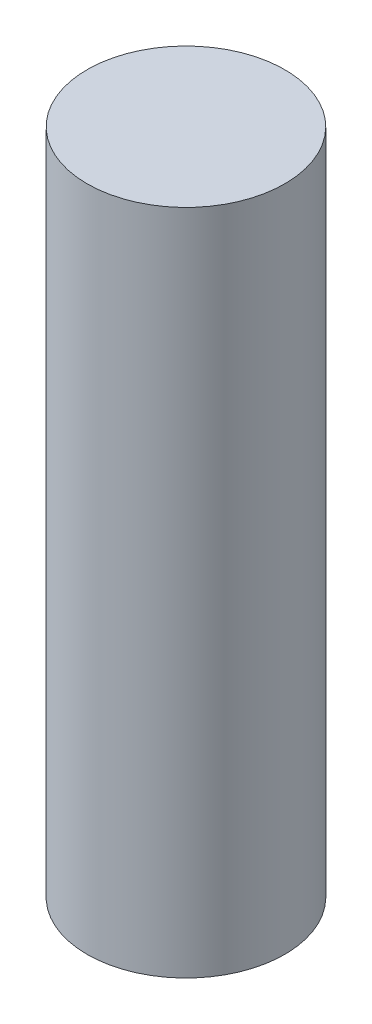
from build123d import *

# Parameters (mm, degrees)
SKETCH1_R           = 4
BOSS_EXTRUDE1_DEPTH = 13.5


with BuildPart() as part:
    # Sketch1 → Boss-Extrude1 (new, symmetric)
    with BuildSketch(Plane(origin=(0, 0, 0), x_dir=(1, 0, 0), z_dir=(0, 1, 0))):
        Circle(SKETCH1_R)
    extrude(amount=BOSS_EXTRUDE1_DEPTH, both=True)


solid = part.part
